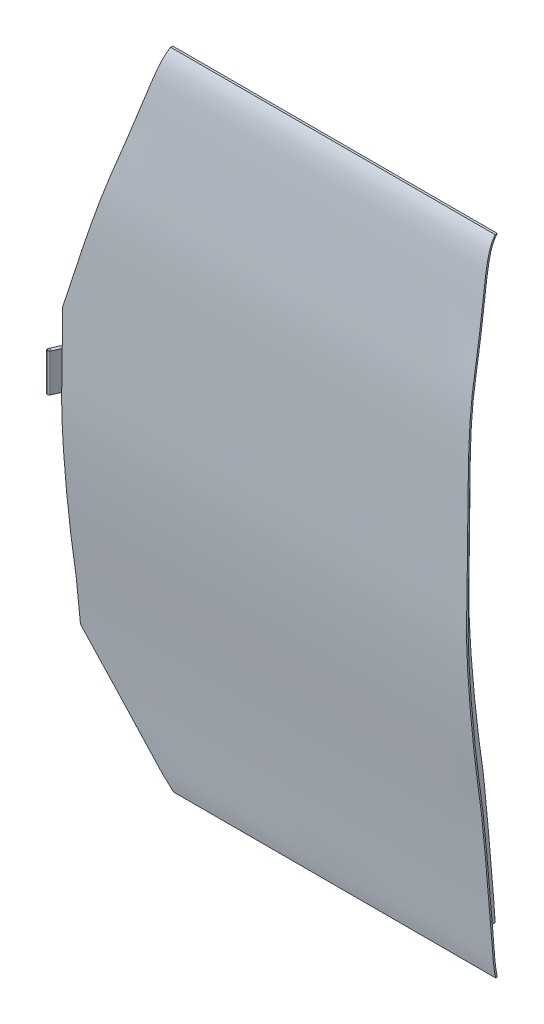
from build123d import *

# Parameters (mm, degrees)
SKETCH1_R           = 2.5
TOP_HINGE_DEPTH     = 95
EXTRUDE_THIN1_START = 10
EXTRUDE_THIN1_DEPTH = 1042.268646407
SKETCH8_W           = 1052.268646407
SKETCH8_H           = 1621
CUT_EXTRUDE1_DEPTH  = 1355.334678767
SKETCH9_W           = 4
SKETCH9_H           = 1613
CUT_EXTRUDE3_DEPTH  = 1352.194861813
BOSS_EXTRUDE1_REACH = 1499.313
BOSS_EXTRUDE1_START = -150
CUT_EXTRUDE5_DEPTH  = 1354.828480502
SKETCH13_W          = 40
SKETCH13_H          = 150
BOSS_EXTRUDE2_DEPTH = 4
SKETCH14_R          = 3
BOSS_EXTRUDE3_DEPTH = 95
SKETCH15_W          = 40
SKETCH15_H          = 110
BOSS_EXTRUDE4_DEPTH = 4


# Read off the part's stored shape, not the designer's step: Extrude-Thin1
with BuildPart() as part:
    # Sketch1 → Top Hinge (new body)
    with BuildSketch(Plane(origin=(0, 0, 0), x_dir=(1, 0, 0), z_dir=(0, 1, 0))):
        with Locations(Location((0, 0, 0), (0, 0, 270))):
            Circle(SKETCH1_R)
    extrude(amount=TOP_HINGE_DEPTH)


with BuildPart() as body_2:
    # Extrude-Thin1 outline → Extrude-Thin1 (new body)
    with BuildSketch(Plane(origin=(0, 0, 0), x_dir=(0, 0, -1), z_dir=(1, 0, 0)).offset(EXTRUDE_THIN1_START)):
        with BuildLine():
            Line((124, 842.5), (68.269697671, 842.5))
            add(Edge.make_bspline(
                [(68.269697671, 842.5), (67.900386054, 842.106939502), (67.531074437, 841.713879003), (66.792451203, 840.927758006), (66.428575458, 840.53137789), (65.360947605, 839.327581419), (64.677525271, 838.50774993), (62.705531714, 836.000454854), (61.495116223, 834.26526255), (58.126937486, 828.899033489), (56.230275403, 825.108545547), (53.744351557, 819.203534555), (52.974323697, 817.192728746), (51.549560984, 813.159655469), (50.892391657, 811.132494025), (49.04983414, 805.026194928), (47.991471827, 800.922612871), (46.085271563, 792.674936202), (45.23848348, 788.530639557), (43.679500523, 780.216145634), (42.9678306, 776.045847334), (41.630749647, 767.688651384), (41.005619707, 763.501699641), (39.809689432, 755.11734116), (39.239048246, 750.919903796), (37.576023607, 738.318181771), (36.530583372, 729.904479055), (34.462624117, 713.076715312), (33.441211101, 704.661401786), (31.369238632, 687.83409525), (30.319230563, 679.422039424), (28.161979561, 662.604448268), (27.055001543, 654.198882758), (23.62518555, 628.994590635), (21.1917646, 612.208462217), (17.935716268, 591.250212709), (17.27294391, 587.05988009), (15.931366206, 578.681041414), (15.254246409, 574.492343331), (13.232227807, 561.925184931), (11.897862769, 553.54552455), (9.373023747, 536.769810962), (8.182144648, 528.373803906), (6.565309752, 515.76048484), (6.05438757, 511.552852647), (5.096619391, 503.130288365), (4.650064621, 498.915323098), (3.395432595, 486.260739969), (2.67181612, 477.811499889), (1.400033246, 460.893031532), (0.852075358, 452.423779499), (-0.583819503, 426.992329358), (-1.265951767, 410.006340232), (-2.291281792, 375.9971358), (-2.632175831, 358.994511851), (-3.130824024, 324.991373155), (-3.287149995, 307.990874856), (-3.495748492, 282.490425585), (-3.561011852, 273.990324999), (-3.704910499, 256.989969825), (-3.785717119, 248.489690229), (-4.058352923, 222.988503447), (-4.277555473, 205.987281006), (-4.761205914, 171.984315037), (-5.02251517, 154.982607657), (-5.566255497, 120.97894964), (-5.852315612, 103.976957208), (-6.2677527, 78.4741258), (-6.403601048, 69.973212295), (-6.65048515, 52.971671048), (-6.761991369, 44.471037888), (-6.918746641, 27.470534645), (-6.963621991, 18.970668865), (-6.915449415, 1.972525753), (-6.819064907, -6.525713152), (-6.437898601, -23.520021213), (-6.153458803, -32.016094307), (-5.444867881, -49.006631454), (-5.026973051, -57.501167562), (-3.642802546, -82.98327309), (-2.534236167, -99.969203765), (-0.046846142, -133.937952593), (1.32817426, -150.920814547), (4.300563655, -184.883977691), (5.899405681, -201.866607742), (9.327169515, -235.801732832), (11.156259478, -252.757180071), (15.086100616, -286.639506591), (17.185913303, -303.566484563), (20.604954765, -328.92862951), (21.78994677, -337.377912856), (23.650022514, -350.043152928), (24.28546609, -354.263278223), (25.525952438, -362.70672577), (26.130014228, -366.930151182), (27.861680191, -379.608894858), (28.91063307, -388.07248411), (30.865393681, -405.014715794), (31.773444557, -413.493122335), (33.532949291, -430.455887174), (34.382268219, -438.940469981), (36.046293369, -455.913275476), (36.860438518, -464.401557166), (39.266338862, -489.870244276), (40.822286835, -506.854415193), (43.87505794, -540.828974609), (45.371112846, -557.819443895), (48.31365755, -591.805594745), (49.760457403, -608.801243705), (52.597001881, -642.798541564), (53.990879791, -659.799755808), (55.647829978, -681.060254002), (55.974903492, -685.312807568), (56.623192692, -693.81853071), (56.944131285, -698.071729425), (57.592401892, -706.577454522), (57.919428859, -710.830012982), (58.594083523, -719.332963525), (58.941003489, -723.583430033), (59.692100735, -732.078341856), (60.096180098, -736.322797468), (60.805147455, -742.678665333), (61.059108936, -744.79543303), (61.610647957, -749.024381748), (61.908413325, -751.136543018), (62.865204973, -757.46634962), (63.58795499, -761.67729375), (65.101861619, -770.091988354), (65.892291671, -774.295815235), (66.67931849, -778.5)],
                knots=[0, 0, 0, 0, 0.000976562, 0.000976562, 0.001953125, 0.001953125, 0.00390625, 0.00390625, 0.0078125, 0.0078125, 0.015625, 0.015625, 0.01953125, 0.01953125, 0.0234375, 0.0234375, 0.03125, 0.03125, 0.0390625, 0.0390625, 0.046875, 0.046875, 0.0546875, 0.0546875, 0.0625, 0.0625, 0.078125, 0.078125, 0.09375, 0.09375, 0.109375, 0.109375, 0.125, 0.125, 0.15625, 0.15625, 0.1640625, 0.1640625, 0.171875, 0.171875, 0.1875, 0.1875, 0.203125, 0.203125, 0.2109375, 0.2109375, 0.21875, 0.21875, 0.234375, 0.234375, 0.25, 0.25, 0.28125, 0.28125, 0.3125, 0.3125, 0.34375, 0.34375, 0.359375, 0.359375, 0.375, 0.375, 0.40625, 0.40625, 0.4375, 0.4375, 0.46875, 0.46875, 0.484375, 0.484375, 0.5, 0.5, 0.515625, 0.515625, 0.53125, 0.53125, 0.546875, 0.546875, 0.5625, 0.5625, 0.59375, 0.59375, 0.625, 0.625, 0.65625, 0.65625, 0.6875, 0.6875, 0.71875, 0.71875, 0.734375, 0.734375, 0.7421875, 0.7421875, 0.75, 0.75, 0.765625, 0.765625, 0.78125, 0.78125, 0.796875, 0.796875, 0.8125, 0.8125, 0.84375, 0.84375, 0.875, 0.875, 0.90625, 0.90625, 0.9375, 0.9375, 0.9453125, 0.9453125, 0.953125, 0.953125, 0.9609375, 0.9609375, 0.96875, 0.96875, 0.9765625, 0.9765625, 0.98046875, 0.98046875, 0.984375, 0.984375, 0.9921875, 0.9921875, 1, 1, 1, 1], degree=3))
            Line((66.67931849, -778.5), (124, -778.5))
            Line((124, -778.5), (124, 842.5))
        make_face()
        with BuildLine():
            add(Edge.make_bspline(
                [(70, 838.5), (42.497518882, 809.228949652), (45.719808186, 726.515601283), (0.918648629, 466.786858139), (1.054983073, 301.803948458), (-2.579540812, 38.733436677), (-4.4912399, 2.362739998), (3.732553991, -142.310353717), (16.755237866, -282.069628521), (36.579897431, -406.647155459), (56.348873164, -636.569727618), (64.131405371, -740.644920213), (65.038990892, -747.9989985), (70, -774.5)],
                knots=[0, 0, 0, 0, 0.220019225, 0.256002584, 0.348296811, 0.384354606, 0.580522737, 0.62673056, 0.800225008, 0.83087557, 0.902585615, 0.920394434, 1, 1, 1, 1], degree=3))
            Line((70, 838.5), (120, 838.5))
            Line((120, 838.5), (120, -774.5))
            Line((120, -774.5), (70, -774.5))
        make_face(mode=Mode.SUBTRACT)
    extrude(amount=EXTRUDE_THIN1_DEPTH)

    # Sketch8 → Cut-Extrude1 (cut, through all)
    with BuildSketch(Plane(origin=(0, 0, -124), x_dir=(-1, 0, 0), z_dir=(0, 0, -1))):
        with Locations((-536.134323204, 32)):
            Rectangle(SKETCH8_W, SKETCH8_H)
        Polygon((-1052.268646407, 838.5), (-1052.268646407, -774.5), (-245.768646407, -774.5), (-38, -501.587578938), (-38, 209.412421062), (-239.268646407, 838.5), align=None, mode=Mode.SUBTRACT)
    extrude(amount=-CUT_EXTRUDE1_DEPTH, mode=Mode.SUBTRACT)


with BuildPart() as cut_extrude1_piece_1:
    # of the separate pieces the step leaves, piece 1, a body of its own (cut_extrude1_pieces)
    add(body_2.part.solids().sort_by_distance((1052.268646407, -774.5, -124))[0])

    # Sketch9 → Cut-Extrude3 (cut, through all)
    with BuildSketch(Plane(origin=(0, 0, 0), x_dir=(0, 0, -1), z_dir=(1, 0, 0))):
        with Locations((122, 32)):
            Rectangle(SKETCH9_W, SKETCH9_H)
    extrude(amount=CUT_EXTRUDE3_DEPTH, mode=Mode.SUBTRACT)


with BuildPart() as cut_extrude1_piece_2:
    # of the separate pieces the step leaves, piece 2, a body of its own (cut_extrude1_pieces)
    add(body_2.part.solids().sort_by_distance((1052.268646407, 838.5, -64.684351472))[0])

    # Sketch10 → Boss-Extrude1 (add, up to next)
    with BuildSketch(Plane.XY.offset(BOSS_EXTRUDE1_START), mode=Mode.PRIVATE) as boss_extrude1_sk1:
        Polygon((976.268646407, 762.5), (262.200402423, 762.5), (63.5, 141.439753778), (63.5, -460.793487002), (268.066682121, -729.5), (976.268646407, -729.5), align=None)
    boss_extrude1_tool1 = extrude(boss_extrude1_sk1.sketch, amount=BOSS_EXTRUDE1_REACH, mode=Mode.PRIVATE) - cut_extrude1_piece_2.part
    add(boss_extrude1_tool1.solids().sort_by_distance((547.183362, 4.544841, -150))[0])

    # Sketch11 → Cut-Extrude5 (cut, through all)
    with BuildSketch(Plane(origin=(0, 0, 0), x_dir=(0, 0, -1), z_dir=(1, 0, 0))):
        with BuildLine():
            Line((146, -774.5), (196, -774.5))
            Line((196, -774.5), (196, 838.5))
            Line((196, 838.5), (146, 838.5))
            add(Edge.make_bspline(
                [(146, -774.5), (141.038990892, -747.9989985), (141.758073226, -740.644920213), (133.82520292, -636.569727618), (114.131497549, -406.647155459), (94.275521669, -282.069628521), (81.275299222, -142.310353717), (73.049117424, 2.362739998), (74.959801137, 38.733436677), (78.59766733, 301.803948458), (78.450278314, 466.786858139), (123.291060931, 726.515601283), (118.497518882, 809.228949652), (146, 838.5)],
                knots=[0, 0, 0, 0, 0.079605566, 0.097414385, 0.16912443, 0.199774992, 0.37326944, 0.419477263, 0.615645394, 0.651703189, 0.743997416, 0.779980775, 1, 1, 1, 1], degree=3))
        make_face()
    extrude(amount=CUT_EXTRUDE5_DEPTH, mode=Mode.SUBTRACT)

    # Sketch13 → Boss-Extrude2 (add)
    with BuildSketch(Plane.ZY.offset(-63.5)):
        with Locations((-25, 47.5)):
            Rectangle(SKETCH13_W, SKETCH13_H)
    extrude(amount=BOSS_EXTRUDE2_DEPTH)

    # Sketch14 → Boss-Extrude3 (add)
    with BuildSketch(Plane(origin=(0, 95, 0), x_dir=(1, 0, 0), z_dir=(0, 1, 0))):
        with BuildLine():
            Line((59.5, 29.658960902), (14.5, 41.725098188))
            Line((14.5, 41.725098188), (-4.078052845, 1.902494414))
            ThreePointArc((-4.078052845, 1.902494414), (-1.902494414, -4.078052845), (4.078052845, -1.902494414))
            Line((4.078052845, -1.902494414), (19.463340966, 31.076324083))
            Line((19.463340966, 31.076324083), (59.5, 20.341039098))
            Line((59.5, 20.341039098), (59.5, 29.658960902))
        make_face()
        with Locations(Location((0, 0, 0), (0, 0, 270))):
            Circle(SKETCH14_R, mode=Mode.SUBTRACT)
    extrude(amount=-BOSS_EXTRUDE3_DEPTH)

    # Sketch15 → Boss-Extrude4 (add)
    with BuildSketch(Plane.ZY.offset(-63.5)):
        with Locations((-65.478503704, -402.5)):
            Rectangle(SKETCH15_W, SKETCH15_H)
    extrude(amount=BOSS_EXTRUDE4_DEPTH)


solid = Compound([part.part, cut_extrude1_piece_2.part])
